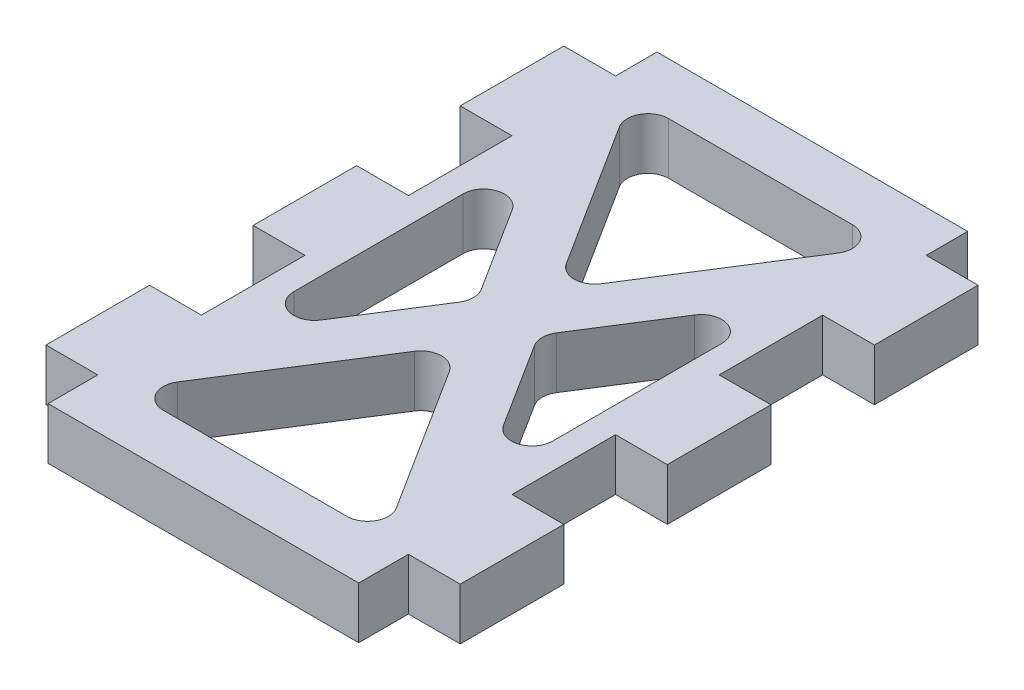
from build123d import *

# Parameters (mm, degrees)
SKETCH1_W            = 50.8
SKETCH1_H            = 74.676
MAIN_DEPTH           = 6.35
SKETCH2_W            = 6.35
SKETCH2_H            = 5.08
SKETCH2_H_2          = 12.7
SKETCH2_H_3          = 6.096
ACRYLIC_MOUNTS_DEPTH = 46.602727375
CUT_EXTRUDE2_DEPTH   = 46.602727375
FILLET1_R            = 2.54


with BuildPart() as part:
    # Sketch1 → Main (new body)
    with BuildSketch(Plane(origin=(0, 0, 0), x_dir=(1, 0, 0), z_dir=(0, 1, 0))):
        Rectangle(SKETCH1_W, SKETCH1_H)
    extrude(amount=MAIN_DEPTH)

    # Sketch2 → Acrylic Mounts (cut, through all)
    with BuildSketch(Plane(origin=(0, 6.35, 0), x_dir=(1, 0, 0), z_dir=(0, 1, 0))):
        with Locations((22.225, 34.798)):
            Rectangle(SKETCH2_W, SKETCH2_H)
        with Locations((22.225, 13.208)):
            Rectangle(SKETCH2_W, SKETCH2_H_2)
        with Locations((22.225, -12.192)):
            Rectangle(SKETCH2_W, SKETCH2_H_2)
        with Locations((22.225, -34.29)):
            Rectangle(SKETCH2_W, SKETCH2_H_3)
        with Locations((-22.225, -34.29)):
            Rectangle(SKETCH2_W, SKETCH2_H_3)
        with Locations((-22.225, -12.192)):
            Rectangle(SKETCH2_W, SKETCH2_H_2)
        with Locations((-22.225, 13.208)):
            Rectangle(SKETCH2_W, SKETCH2_H_2)
        with Locations((-22.225, 34.798)):
            Rectangle(SKETCH2_W, SKETCH2_H)
    extrude(amount=-ACRYLIC_MOUNTS_DEPTH, mode=Mode.SUBTRACT)

    # Sketch3 → Cut-Extrude2 (cut, through all)
    with BuildSketch(Plane(origin=(0, 6.35, 0), x_dir=(1, 0, 0), z_dir=(0, 1, 0))):
        Polygon((-15.875, 30.988), (0, 5.932297535), (15.875, 30.988), align=None)
        Polygon((-15.875, 19.12340493), (-3.758634327, 0), (-15.875, -19.12340493), align=None)
        Polygon((-15.875, -30.988), (0, -5.932297535), (15.875, -30.988), align=None)
        Polygon((15.875, -19.12340493), (3.758634327, 0), (15.875, 19.12340493), align=None)
    extrude(amount=-CUT_EXTRUDE2_DEPTH, mode=Mode.SUBTRACT)

    # Fillet1
    fillet1_edges = [part.edges().sort_by_distance(p)[0] for p in [
        (15.875, 3.175, 30.988),
        (15.875, 3.175, 19.12340493),
        (-15.875, 3.175, 30.988),
        (-15.875, 3.175, 19.12340493),
        (0, 3.175, -5.932297535),
        (-15.875, 3.175, -19.12340493),
        (0, 3.175, 5.932297535),
        (-3.758634327, 3.175, 0),
        (15.875, 3.175, -19.12340493),
        (15.875, 3.175, -30.988),
        (3.758634327, 3.175, 0),
        (-15.875, 3.175, -30.988),
    ]]
    fillet(fillet1_edges, radius=FILLET1_R)


solid = part.part
